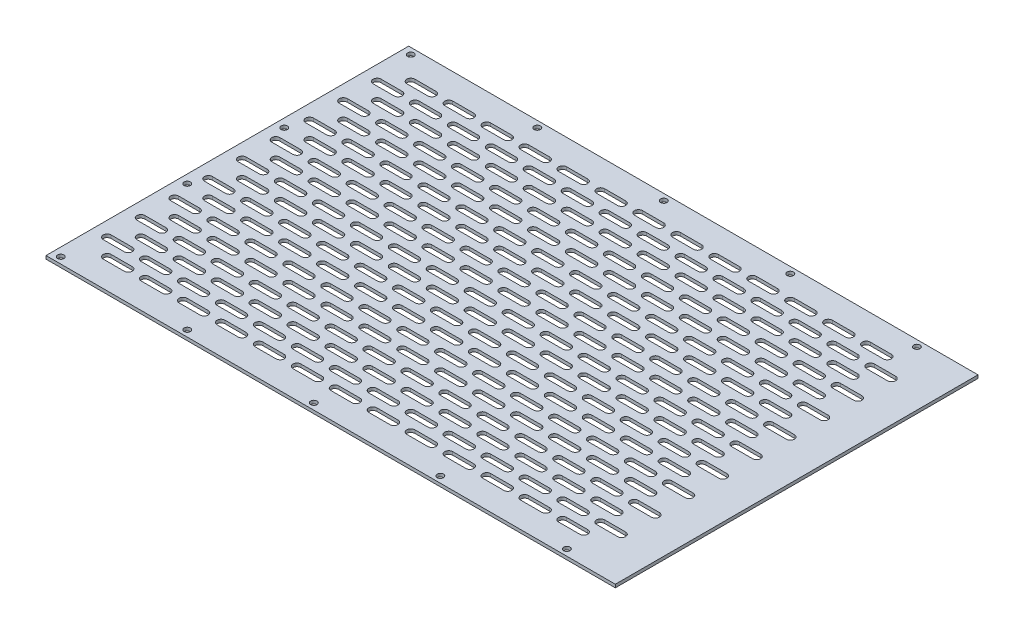
from build123d import *

# Parameters (mm, degrees)
SKETCH1_W           = 270
SKETCH1_H           = 172
SKETCH1_R           = 1.5
BOSS_EXTRUDE1_DEPTH = 1.5


with BuildPart() as part:
    # Sketch1 → Boss-Extrude1 (new body)
    with BuildSketch(Plane(origin=(0, 0, 0), x_dir=(1, 0, 0), z_dir=(0, 1, 0))):
        Rectangle(SKETCH1_W, SKETCH1_H)
        with Locations((-131, -83)):
            Circle(SKETCH1_R, mode=Mode.SUBTRACT)
        with Locations((-71, -83)):
            Circle(SKETCH1_R, mode=Mode.SUBTRACT)
        with Locations((-11, -83)):
            Circle(SKETCH1_R, mode=Mode.SUBTRACT)
        with Locations((49, -83)):
            Circle(SKETCH1_R, mode=Mode.SUBTRACT)
        with Locations((109, -83)):
            Circle(SKETCH1_R, mode=Mode.SUBTRACT)
        with Locations((-131, -23)):
            Circle(SKETCH1_R, mode=Mode.SUBTRACT)
        with Locations((109, 83)):
            Circle(SKETCH1_R, mode=Mode.SUBTRACT)
        with Locations((49, 83)):
            Circle(SKETCH1_R, mode=Mode.SUBTRACT)
        with Locations((-11, 83)):
            Circle(SKETCH1_R, mode=Mode.SUBTRACT)
        with Locations((-71, 83)):
            Circle(SKETCH1_R, mode=Mode.SUBTRACT)
        with Locations((-131, 83)):
            Circle(SKETCH1_R, mode=Mode.SUBTRACT)
        with Locations((-131, 23)):
            Circle(SKETCH1_R, mode=Mode.SUBTRACT)
        with BuildLine():
            Line((-120, 73.9), (-110, 73.9))
            ThreePointArc((-110, 73.9), (-108.1, 72), (-110, 70.1))
            Line((-110, 70.1), (-120, 70.1))
            ThreePointArc((-120, 70.1), (-121.9, 72), (-120, 73.9))
        make_face(mode=Mode.SUBTRACT)
        with BuildLine():
            Line((-102, 73.9), (-92, 73.9))
            ThreePointArc((-92, 73.9), (-90.1, 72), (-92, 70.1))
            Line((-92, 70.1), (-102, 70.1))
            ThreePointArc((-102, 70.1), (-103.9, 72), (-102, 73.9))
        make_face(mode=Mode.SUBTRACT)
        with BuildLine():
            Line((-84, 73.9), (-74, 73.9))
            ThreePointArc((-74, 73.9), (-72.1, 72), (-74, 70.1))
            Line((-74, 70.1), (-84, 70.1))
            ThreePointArc((-84, 70.1), (-85.9, 72), (-84, 73.9))
        make_face(mode=Mode.SUBTRACT)
        with BuildLine():
            Line((-66, 73.9), (-56, 73.9))
            ThreePointArc((-56, 73.9), (-54.1, 72), (-56, 70.1))
            Line((-56, 70.1), (-66, 70.1))
            ThreePointArc((-66, 70.1), (-67.9, 72), (-66, 73.9))
        make_face(mode=Mode.SUBTRACT)
        with BuildLine():
            Line((-48, 73.9), (-38, 73.9))
            ThreePointArc((-38, 73.9), (-36.1, 72), (-38, 70.1))
            Line((-38, 70.1), (-48, 70.1))
            ThreePointArc((-48, 70.1), (-49.9, 72), (-48, 73.9))
        make_face(mode=Mode.SUBTRACT)
        with BuildLine():
            Line((-30, 73.9), (-20, 73.9))
            ThreePointArc((-20, 73.9), (-18.1, 72), (-20, 70.1))
            Line((-20, 70.1), (-30, 70.1))
            ThreePointArc((-30, 70.1), (-31.9, 72), (-30, 73.9))
        make_face(mode=Mode.SUBTRACT)
        with BuildLine():
            Line((-12, 73.9), (-2, 73.9))
            ThreePointArc((-2, 73.9), (-0.1, 72), (-2, 70.1))
            Line((-2, 70.1), (-12, 70.1))
            ThreePointArc((-12, 70.1), (-13.9, 72), (-12, 73.9))
        make_face(mode=Mode.SUBTRACT)
        with BuildLine():
            Line((6, 73.9), (16, 73.9))
            ThreePointArc((16, 73.9), (17.9, 72), (16, 70.1))
            Line((16, 70.1), (6, 70.1))
            ThreePointArc((6, 70.1), (4.1, 72), (6, 73.9))
        make_face(mode=Mode.SUBTRACT)
        with BuildLine():
            Line((24, 73.9), (34, 73.9))
            ThreePointArc((34, 73.9), (35.9, 72), (34, 70.1))
            Line((34, 70.1), (24, 70.1))
            ThreePointArc((24, 70.1), (22.1, 72), (24, 73.9))
        make_face(mode=Mode.SUBTRACT)
        with BuildLine():
            Line((42, 73.9), (52, 73.9))
            ThreePointArc((52, 73.9), (53.9, 72), (52, 70.1))
            Line((52, 70.1), (42, 70.1))
            ThreePointArc((42, 70.1), (40.1, 72), (42, 73.9))
        make_face(mode=Mode.SUBTRACT)
        with BuildLine():
            Line((60, 73.9), (70, 73.9))
            ThreePointArc((70, 73.9), (71.9, 72), (70, 70.1))
            Line((70, 70.1), (60, 70.1))
            ThreePointArc((60, 70.1), (58.1, 72), (60, 73.9))
        make_face(mode=Mode.SUBTRACT)
        with BuildLine():
            Line((78, 73.9), (88, 73.9))
            ThreePointArc((88, 73.9), (89.9, 72), (88, 70.1))
            Line((88, 70.1), (78, 70.1))
            ThreePointArc((78, 70.1), (76.1, 72), (78, 73.9))
        make_face(mode=Mode.SUBTRACT)
        with BuildLine():
            Line((96, 73.9), (106, 73.9))
            ThreePointArc((106, 73.9), (107.9, 72), (106, 70.1))
            Line((106, 70.1), (96, 70.1))
            ThreePointArc((96, 70.1), (94.1, 72), (96, 73.9))
        make_face(mode=Mode.SUBTRACT)
        with BuildLine():
            Line((-102, 57.9), (-92, 57.9))
            ThreePointArc((-92, 57.9), (-90.1, 56), (-92, 54.1))
            Line((-92, 54.1), (-102, 54.1))
            ThreePointArc((-102, 54.1), (-103.9, 56), (-102, 57.9))
        make_face(mode=Mode.SUBTRACT)
        with BuildLine():
            Line((-84, 57.9), (-74, 57.9))
            ThreePointArc((-74, 57.9), (-72.1, 56), (-74, 54.1))
            Line((-74, 54.1), (-84, 54.1))
            ThreePointArc((-84, 54.1), (-85.9, 56), (-84, 57.9))
        make_face(mode=Mode.SUBTRACT)
        with BuildLine():
            Line((-66, 57.9), (-56, 57.9))
            ThreePointArc((-56, 57.9), (-54.1, 56), (-56, 54.1))
            Line((-56, 54.1), (-66, 54.1))
            ThreePointArc((-66, 54.1), (-67.9, 56), (-66, 57.9))
        make_face(mode=Mode.SUBTRACT)
        with BuildLine():
            Line((-48, 57.9), (-38, 57.9))
            ThreePointArc((-38, 57.9), (-36.1, 56), (-38, 54.1))
            Line((-38, 54.1), (-48, 54.1))
            ThreePointArc((-48, 54.1), (-49.9, 56), (-48, 57.9))
        make_face(mode=Mode.SUBTRACT)
        with BuildLine():
            Line((-30, 57.9), (-20, 57.9))
            ThreePointArc((-20, 57.9), (-18.1, 56), (-20, 54.1))
            Line((-20, 54.1), (-30, 54.1))
            ThreePointArc((-30, 54.1), (-31.9, 56), (-30, 57.9))
        make_face(mode=Mode.SUBTRACT)
        with BuildLine():
            Line((-12, 57.9), (-2, 57.9))
            ThreePointArc((-2, 57.9), (-0.1, 56), (-2, 54.1))
            Line((-2, 54.1), (-12, 54.1))
            ThreePointArc((-12, 54.1), (-13.9, 56), (-12, 57.9))
        make_face(mode=Mode.SUBTRACT)
        with BuildLine():
            Line((6, 57.9), (16, 57.9))
            ThreePointArc((16, 57.9), (17.9, 56), (16, 54.1))
            Line((16, 54.1), (6, 54.1))
            ThreePointArc((6, 54.1), (4.1, 56), (6, 57.9))
        make_face(mode=Mode.SUBTRACT)
        with BuildLine():
            Line((24, 57.9), (34, 57.9))
            ThreePointArc((34, 57.9), (35.9, 56), (34, 54.1))
            Line((34, 54.1), (24, 54.1))
            ThreePointArc((24, 54.1), (22.1, 56), (24, 57.9))
        make_face(mode=Mode.SUBTRACT)
        with BuildLine():
            Line((42, 57.9), (52, 57.9))
            ThreePointArc((52, 57.9), (53.9, 56), (52, 54.1))
            Line((52, 54.1), (42, 54.1))
            ThreePointArc((42, 54.1), (40.1, 56), (42, 57.9))
        make_face(mode=Mode.SUBTRACT)
        with BuildLine():
            Line((60, 57.9), (70, 57.9))
            ThreePointArc((70, 57.9), (71.9, 56), (70, 54.1))
            Line((70, 54.1), (60, 54.1))
            ThreePointArc((60, 54.1), (58.1, 56), (60, 57.9))
        make_face(mode=Mode.SUBTRACT)
        with BuildLine():
            Line((78, 57.9), (88, 57.9))
            ThreePointArc((88, 57.9), (89.9, 56), (88, 54.1))
            Line((88, 54.1), (78, 54.1))
            ThreePointArc((78, 54.1), (76.1, 56), (78, 57.9))
        make_face(mode=Mode.SUBTRACT)
        with BuildLine():
            Line((-102, 41.9), (-92, 41.9))
            ThreePointArc((-92, 41.9), (-90.1, 40), (-92, 38.1))
            Line((-92, 38.1), (-102, 38.1))
            ThreePointArc((-102, 38.1), (-103.9, 40), (-102, 41.9))
        make_face(mode=Mode.SUBTRACT)
        with BuildLine():
            Line((-84, 41.9), (-74, 41.9))
            ThreePointArc((-74, 41.9), (-72.1, 40), (-74, 38.1))
            Line((-74, 38.1), (-84, 38.1))
            ThreePointArc((-84, 38.1), (-85.9, 40), (-84, 41.9))
        make_face(mode=Mode.SUBTRACT)
        with BuildLine():
            Line((-66, 41.9), (-56, 41.9))
            ThreePointArc((-56, 41.9), (-54.1, 40), (-56, 38.1))
            Line((-56, 38.1), (-66, 38.1))
            ThreePointArc((-66, 38.1), (-67.9, 40), (-66, 41.9))
        make_face(mode=Mode.SUBTRACT)
        with BuildLine():
            Line((-48, 41.9), (-38, 41.9))
            ThreePointArc((-38, 41.9), (-36.1, 40), (-38, 38.1))
            Line((-38, 38.1), (-48, 38.1))
            ThreePointArc((-48, 38.1), (-49.9, 40), (-48, 41.9))
        make_face(mode=Mode.SUBTRACT)
        with BuildLine():
            Line((-30, 41.9), (-20, 41.9))
            ThreePointArc((-20, 41.9), (-18.1, 40), (-20, 38.1))
            Line((-20, 38.1), (-30, 38.1))
            ThreePointArc((-30, 38.1), (-31.9, 40), (-30, 41.9))
        make_face(mode=Mode.SUBTRACT)
        with BuildLine():
            Line((-12, 41.9), (-2, 41.9))
            ThreePointArc((-2, 41.9), (-0.1, 40), (-2, 38.1))
            Line((-2, 38.1), (-12, 38.1))
            ThreePointArc((-12, 38.1), (-13.9, 40), (-12, 41.9))
        make_face(mode=Mode.SUBTRACT)
        with BuildLine():
            Line((6, 41.9), (16, 41.9))
            ThreePointArc((16, 41.9), (17.9, 40), (16, 38.1))
            Line((16, 38.1), (6, 38.1))
            ThreePointArc((6, 38.1), (4.1, 40), (6, 41.9))
        make_face(mode=Mode.SUBTRACT)
        with BuildLine():
            Line((24, 41.9), (34, 41.9))
            ThreePointArc((34, 41.9), (35.9, 40), (34, 38.1))
            Line((34, 38.1), (24, 38.1))
            ThreePointArc((24, 38.1), (22.1, 40), (24, 41.9))
        make_face(mode=Mode.SUBTRACT)
        with BuildLine():
            Line((42, 41.9), (52, 41.9))
            ThreePointArc((52, 41.9), (53.9, 40), (52, 38.1))
            Line((52, 38.1), (42, 38.1))
            ThreePointArc((42, 38.1), (40.1, 40), (42, 41.9))
        make_face(mode=Mode.SUBTRACT)
        with BuildLine():
            Line((60, 41.9), (70, 41.9))
            ThreePointArc((70, 41.9), (71.9, 40), (70, 38.1))
            Line((70, 38.1), (60, 38.1))
            ThreePointArc((60, 38.1), (58.1, 40), (60, 41.9))
        make_face(mode=Mode.SUBTRACT)
        with BuildLine():
            Line((78, 41.9), (88, 41.9))
            ThreePointArc((88, 41.9), (89.9, 40), (88, 38.1))
            Line((88, 38.1), (78, 38.1))
            ThreePointArc((78, 38.1), (76.1, 40), (78, 41.9))
        make_face(mode=Mode.SUBTRACT)
        with BuildLine():
            Line((96, 57.9), (106, 57.9))
            ThreePointArc((106, 57.9), (107.9, 56), (106, 54.1))
            Line((106, 54.1), (96, 54.1))
            ThreePointArc((96, 54.1), (94.1, 56), (96, 57.9))
        make_face(mode=Mode.SUBTRACT)
        with BuildLine():
            Line((-102, 25.9), (-92, 25.9))
            ThreePointArc((-92, 25.9), (-90.1, 24), (-92, 22.1))
            Line((-92, 22.1), (-102, 22.1))
            ThreePointArc((-102, 22.1), (-103.9, 24), (-102, 25.9))
        make_face(mode=Mode.SUBTRACT)
        with BuildLine():
            Line((-84, 25.9), (-74, 25.9))
            ThreePointArc((-74, 25.9), (-72.1, 24), (-74, 22.1))
            Line((-74, 22.1), (-84, 22.1))
            ThreePointArc((-84, 22.1), (-85.9, 24), (-84, 25.9))
        make_face(mode=Mode.SUBTRACT)
        with BuildLine():
            Line((-66, 25.9), (-56, 25.9))
            ThreePointArc((-56, 25.9), (-54.1, 24), (-56, 22.1))
            Line((-56, 22.1), (-66, 22.1))
            ThreePointArc((-66, 22.1), (-67.9, 24), (-66, 25.9))
        make_face(mode=Mode.SUBTRACT)
        with BuildLine():
            Line((-48, 25.9), (-38, 25.9))
            ThreePointArc((-38, 25.9), (-36.1, 24), (-38, 22.1))
            Line((-38, 22.1), (-48, 22.1))
            ThreePointArc((-48, 22.1), (-49.9, 24), (-48, 25.9))
        make_face(mode=Mode.SUBTRACT)
        with BuildLine():
            Line((-30, 25.9), (-20, 25.9))
            ThreePointArc((-20, 25.9), (-18.1, 24), (-20, 22.1))
            Line((-20, 22.1), (-30, 22.1))
            ThreePointArc((-30, 22.1), (-31.9, 24), (-30, 25.9))
        make_face(mode=Mode.SUBTRACT)
        with BuildLine():
            Line((-12, 25.9), (-2, 25.9))
            ThreePointArc((-2, 25.9), (-0.1, 24), (-2, 22.1))
            Line((-2, 22.1), (-12, 22.1))
            ThreePointArc((-12, 22.1), (-13.9, 24), (-12, 25.9))
        make_face(mode=Mode.SUBTRACT)
        with BuildLine():
            Line((6, 25.9), (16, 25.9))
            ThreePointArc((16, 25.9), (17.9, 24), (16, 22.1))
            Line((16, 22.1), (6, 22.1))
            ThreePointArc((6, 22.1), (4.1, 24), (6, 25.9))
        make_face(mode=Mode.SUBTRACT)
        with BuildLine():
            Line((24, 25.9), (34, 25.9))
            ThreePointArc((34, 25.9), (35.9, 24), (34, 22.1))
            Line((34, 22.1), (24, 22.1))
            ThreePointArc((24, 22.1), (22.1, 24), (24, 25.9))
        make_face(mode=Mode.SUBTRACT)
        with BuildLine():
            Line((42, 25.9), (52, 25.9))
            ThreePointArc((52, 25.9), (53.9, 24), (52, 22.1))
            Line((52, 22.1), (42, 22.1))
            ThreePointArc((42, 22.1), (40.1, 24), (42, 25.9))
        make_face(mode=Mode.SUBTRACT)
        with BuildLine():
            Line((60, 25.9), (70, 25.9))
            ThreePointArc((70, 25.9), (71.9, 24), (70, 22.1))
            Line((70, 22.1), (60, 22.1))
            ThreePointArc((60, 22.1), (58.1, 24), (60, 25.9))
        make_face(mode=Mode.SUBTRACT)
        with BuildLine():
            Line((78, 25.9), (88, 25.9))
            ThreePointArc((88, 25.9), (89.9, 24), (88, 22.1))
            Line((88, 22.1), (78, 22.1))
            ThreePointArc((78, 22.1), (76.1, 24), (78, 25.9))
        make_face(mode=Mode.SUBTRACT)
        with BuildLine():
            Line((96, 41.9), (106, 41.9))
            ThreePointArc((106, 41.9), (107.9, 40), (106, 38.1))
            Line((106, 38.1), (96, 38.1))
            ThreePointArc((96, 38.1), (94.1, 40), (96, 41.9))
        make_face(mode=Mode.SUBTRACT)
        with BuildLine():
            Line((-102, 9.9), (-92, 9.9))
            ThreePointArc((-92, 9.9), (-90.1, 8), (-92, 6.1))
            Line((-92, 6.1), (-102, 6.1))
            ThreePointArc((-102, 6.1), (-103.9, 8), (-102, 9.9))
        make_face(mode=Mode.SUBTRACT)
        with BuildLine():
            Line((-84, 9.9), (-74, 9.9))
            ThreePointArc((-74, 9.9), (-72.1, 8), (-74, 6.1))
            Line((-74, 6.1), (-84, 6.1))
            ThreePointArc((-84, 6.1), (-85.9, 8), (-84, 9.9))
        make_face(mode=Mode.SUBTRACT)
        with BuildLine():
            Line((-66, 9.9), (-56, 9.9))
            ThreePointArc((-56, 9.9), (-54.1, 8), (-56, 6.1))
            Line((-56, 6.1), (-66, 6.1))
            ThreePointArc((-66, 6.1), (-67.9, 8), (-66, 9.9))
        make_face(mode=Mode.SUBTRACT)
        with BuildLine():
            Line((-48, 9.9), (-38, 9.9))
            ThreePointArc((-38, 9.9), (-36.1, 8), (-38, 6.1))
            Line((-38, 6.1), (-48, 6.1))
            ThreePointArc((-48, 6.1), (-49.9, 8), (-48, 9.9))
        make_face(mode=Mode.SUBTRACT)
        with BuildLine():
            Line((-30, 9.9), (-20, 9.9))
            ThreePointArc((-20, 9.9), (-18.1, 8), (-20, 6.1))
            Line((-20, 6.1), (-30, 6.1))
            ThreePointArc((-30, 6.1), (-31.9, 8), (-30, 9.9))
        make_face(mode=Mode.SUBTRACT)
        with BuildLine():
            Line((-12, 9.9), (-2, 9.9))
            ThreePointArc((-2, 9.9), (-0.1, 8), (-2, 6.1))
            Line((-2, 6.1), (-12, 6.1))
            ThreePointArc((-12, 6.1), (-13.9, 8), (-12, 9.9))
        make_face(mode=Mode.SUBTRACT)
        with BuildLine():
            Line((6, 9.9), (16, 9.9))
            ThreePointArc((16, 9.9), (17.9, 8), (16, 6.1))
            Line((16, 6.1), (6, 6.1))
            ThreePointArc((6, 6.1), (4.1, 8), (6, 9.9))
        make_face(mode=Mode.SUBTRACT)
        with BuildLine():
            Line((24, 9.9), (34, 9.9))
            ThreePointArc((34, 9.9), (35.9, 8), (34, 6.1))
            Line((34, 6.1), (24, 6.1))
            ThreePointArc((24, 6.1), (22.1, 8), (24, 9.9))
        make_face(mode=Mode.SUBTRACT)
        with BuildLine():
            Line((42, 9.9), (52, 9.9))
            ThreePointArc((52, 9.9), (53.9, 8), (52, 6.1))
            Line((52, 6.1), (42, 6.1))
            ThreePointArc((42, 6.1), (40.1, 8), (42, 9.9))
        make_face(mode=Mode.SUBTRACT)
        with BuildLine():
            Line((60, 9.9), (70, 9.9))
            ThreePointArc((70, 9.9), (71.9, 8), (70, 6.1))
            Line((70, 6.1), (60, 6.1))
            ThreePointArc((60, 6.1), (58.1, 8), (60, 9.9))
        make_face(mode=Mode.SUBTRACT)
        with BuildLine():
            Line((78, 9.9), (88, 9.9))
            ThreePointArc((88, 9.9), (89.9, 8), (88, 6.1))
            Line((88, 6.1), (78, 6.1))
            ThreePointArc((78, 6.1), (76.1, 8), (78, 9.9))
        make_face(mode=Mode.SUBTRACT)
        with BuildLine():
            Line((-102, -6.1), (-92, -6.1))
            ThreePointArc((-92, -6.1), (-90.1, -8), (-92, -9.9))
            Line((-92, -9.9), (-102, -9.9))
            ThreePointArc((-102, -9.9), (-103.9, -8), (-102, -6.1))
        make_face(mode=Mode.SUBTRACT)
        with BuildLine():
            Line((-84, -6.1), (-74, -6.1))
            ThreePointArc((-74, -6.1), (-72.1, -8), (-74, -9.9))
            Line((-74, -9.9), (-84, -9.9))
            ThreePointArc((-84, -9.9), (-85.9, -8), (-84, -6.1))
        make_face(mode=Mode.SUBTRACT)
        with BuildLine():
            Line((-66, -6.1), (-56, -6.1))
            ThreePointArc((-56, -6.1), (-54.1, -8), (-56, -9.9))
            Line((-56, -9.9), (-66, -9.9))
            ThreePointArc((-66, -9.9), (-67.9, -8), (-66, -6.1))
        make_face(mode=Mode.SUBTRACT)
        with BuildLine():
            Line((-48, -6.1), (-38, -6.1))
            ThreePointArc((-38, -6.1), (-36.1, -8), (-38, -9.9))
            Line((-38, -9.9), (-48, -9.9))
            ThreePointArc((-48, -9.9), (-49.9, -8), (-48, -6.1))
        make_face(mode=Mode.SUBTRACT)
        with BuildLine():
            Line((-30, -6.1), (-20, -6.1))
            ThreePointArc((-20, -6.1), (-18.1, -8), (-20, -9.9))
            Line((-20, -9.9), (-30, -9.9))
            ThreePointArc((-30, -9.9), (-31.9, -8), (-30, -6.1))
        make_face(mode=Mode.SUBTRACT)
        with BuildLine():
            Line((-12, -6.1), (-2, -6.1))
            ThreePointArc((-2, -6.1), (-0.1, -8), (-2, -9.9))
            Line((-2, -9.9), (-12, -9.9))
            ThreePointArc((-12, -9.9), (-13.9, -8), (-12, -6.1))
        make_face(mode=Mode.SUBTRACT)
        with BuildLine():
            Line((6, -6.1), (16, -6.1))
            ThreePointArc((16, -6.1), (17.9, -8), (16, -9.9))
            Line((16, -9.9), (6, -9.9))
            ThreePointArc((6, -9.9), (4.1, -8), (6, -6.1))
        make_face(mode=Mode.SUBTRACT)
        with BuildLine():
            Line((24, -6.1), (34, -6.1))
            ThreePointArc((34, -6.1), (35.9, -8), (34, -9.9))
            Line((34, -9.9), (24, -9.9))
            ThreePointArc((24, -9.9), (22.1, -8), (24, -6.1))
        make_face(mode=Mode.SUBTRACT)
        with BuildLine():
            Line((42, -6.1), (52, -6.1))
            ThreePointArc((52, -6.1), (53.9, -8), (52, -9.9))
            Line((52, -9.9), (42, -9.9))
            ThreePointArc((42, -9.9), (40.1, -8), (42, -6.1))
        make_face(mode=Mode.SUBTRACT)
        with BuildLine():
            Line((60, -6.1), (70, -6.1))
            ThreePointArc((70, -6.1), (71.9, -8), (70, -9.9))
            Line((70, -9.9), (60, -9.9))
            ThreePointArc((60, -9.9), (58.1, -8), (60, -6.1))
        make_face(mode=Mode.SUBTRACT)
        with BuildLine():
            Line((78, -6.1), (88, -6.1))
            ThreePointArc((88, -6.1), (89.9, -8), (88, -9.9))
            Line((88, -9.9), (78, -9.9))
            ThreePointArc((78, -9.9), (76.1, -8), (78, -6.1))
        make_face(mode=Mode.SUBTRACT)
        with BuildLine():
            Line((96, 25.9), (106, 25.9))
            ThreePointArc((106, 25.9), (107.9, 24), (106, 22.1))
            Line((106, 22.1), (96, 22.1))
            ThreePointArc((96, 22.1), (94.1, 24), (96, 25.9))
        make_face(mode=Mode.SUBTRACT)
        with BuildLine():
            Line((-102, -22.1), (-92, -22.1))
            ThreePointArc((-92, -22.1), (-90.1, -24), (-92, -25.9))
            Line((-92, -25.9), (-102, -25.9))
            ThreePointArc((-102, -25.9), (-103.9, -24), (-102, -22.1))
        make_face(mode=Mode.SUBTRACT)
        with BuildLine():
            Line((-84, -22.1), (-74, -22.1))
            ThreePointArc((-74, -22.1), (-72.1, -24), (-74, -25.9))
            Line((-74, -25.9), (-84, -25.9))
            ThreePointArc((-84, -25.9), (-85.9, -24), (-84, -22.1))
        make_face(mode=Mode.SUBTRACT)
        with BuildLine():
            Line((-66, -22.1), (-56, -22.1))
            ThreePointArc((-56, -22.1), (-54.1, -24), (-56, -25.9))
            Line((-56, -25.9), (-66, -25.9))
            ThreePointArc((-66, -25.9), (-67.9, -24), (-66, -22.1))
        make_face(mode=Mode.SUBTRACT)
        with BuildLine():
            Line((-48, -22.1), (-38, -22.1))
            ThreePointArc((-38, -22.1), (-36.1, -24), (-38, -25.9))
            Line((-38, -25.9), (-48, -25.9))
            ThreePointArc((-48, -25.9), (-49.9, -24), (-48, -22.1))
        make_face(mode=Mode.SUBTRACT)
        with BuildLine():
            Line((-30, -22.1), (-20, -22.1))
            ThreePointArc((-20, -22.1), (-18.1, -24), (-20, -25.9))
            Line((-20, -25.9), (-30, -25.9))
            ThreePointArc((-30, -25.9), (-31.9, -24), (-30, -22.1))
        make_face(mode=Mode.SUBTRACT)
        with BuildLine():
            Line((-12, -22.1), (-2, -22.1))
            ThreePointArc((-2, -22.1), (-0.1, -24), (-2, -25.9))
            Line((-2, -25.9), (-12, -25.9))
            ThreePointArc((-12, -25.9), (-13.9, -24), (-12, -22.1))
        make_face(mode=Mode.SUBTRACT)
        with BuildLine():
            Line((6, -22.1), (16, -22.1))
            ThreePointArc((16, -22.1), (17.9, -24), (16, -25.9))
            Line((16, -25.9), (6, -25.9))
            ThreePointArc((6, -25.9), (4.1, -24), (6, -22.1))
        make_face(mode=Mode.SUBTRACT)
        with BuildLine():
            Line((24, -22.1), (34, -22.1))
            ThreePointArc((34, -22.1), (35.9, -24), (34, -25.9))
            Line((34, -25.9), (24, -25.9))
            ThreePointArc((24, -25.9), (22.1, -24), (24, -22.1))
        make_face(mode=Mode.SUBTRACT)
        with BuildLine():
            Line((42, -22.1), (52, -22.1))
            ThreePointArc((52, -22.1), (53.9, -24), (52, -25.9))
            Line((52, -25.9), (42, -25.9))
            ThreePointArc((42, -25.9), (40.1, -24), (42, -22.1))
        make_face(mode=Mode.SUBTRACT)
        with BuildLine():
            Line((60, -22.1), (70, -22.1))
            ThreePointArc((70, -22.1), (71.9, -24), (70, -25.9))
            Line((70, -25.9), (60, -25.9))
            ThreePointArc((60, -25.9), (58.1, -24), (60, -22.1))
        make_face(mode=Mode.SUBTRACT)
        with BuildLine():
            Line((78, -22.1), (88, -22.1))
            ThreePointArc((88, -22.1), (89.9, -24), (88, -25.9))
            Line((88, -25.9), (78, -25.9))
            ThreePointArc((78, -25.9), (76.1, -24), (78, -22.1))
        make_face(mode=Mode.SUBTRACT)
        with BuildLine():
            Line((96, 9.9), (106, 9.9))
            ThreePointArc((106, 9.9), (107.9, 8), (106, 6.1))
            Line((106, 6.1), (96, 6.1))
            ThreePointArc((96, 6.1), (94.1, 8), (96, 9.9))
        make_face(mode=Mode.SUBTRACT)
        with BuildLine():
            Line((-102, -38.1), (-92, -38.1))
            ThreePointArc((-92, -38.1), (-90.1, -40), (-92, -41.9))
            Line((-92, -41.9), (-102, -41.9))
            ThreePointArc((-102, -41.9), (-103.9, -40), (-102, -38.1))
        make_face(mode=Mode.SUBTRACT)
        with BuildLine():
            Line((-84, -38.1), (-74, -38.1))
            ThreePointArc((-74, -38.1), (-72.1, -40), (-74, -41.9))
            Line((-74, -41.9), (-84, -41.9))
            ThreePointArc((-84, -41.9), (-85.9, -40), (-84, -38.1))
        make_face(mode=Mode.SUBTRACT)
        with BuildLine():
            Line((-66, -38.1), (-56, -38.1))
            ThreePointArc((-56, -38.1), (-54.1, -40), (-56, -41.9))
            Line((-56, -41.9), (-66, -41.9))
            ThreePointArc((-66, -41.9), (-67.9, -40), (-66, -38.1))
        make_face(mode=Mode.SUBTRACT)
        with BuildLine():
            Line((-48, -38.1), (-38, -38.1))
            ThreePointArc((-38, -38.1), (-36.1, -40), (-38, -41.9))
            Line((-38, -41.9), (-48, -41.9))
            ThreePointArc((-48, -41.9), (-49.9, -40), (-48, -38.1))
        make_face(mode=Mode.SUBTRACT)
        with BuildLine():
            Line((-30, -38.1), (-20, -38.1))
            ThreePointArc((-20, -38.1), (-18.1, -40), (-20, -41.9))
            Line((-20, -41.9), (-30, -41.9))
            ThreePointArc((-30, -41.9), (-31.9, -40), (-30, -38.1))
        make_face(mode=Mode.SUBTRACT)
        with BuildLine():
            Line((-12, -38.1), (-2, -38.1))
            ThreePointArc((-2, -38.1), (-0.1, -40), (-2, -41.9))
            Line((-2, -41.9), (-12, -41.9))
            ThreePointArc((-12, -41.9), (-13.9, -40), (-12, -38.1))
        make_face(mode=Mode.SUBTRACT)
        with BuildLine():
            Line((6, -38.1), (16, -38.1))
            ThreePointArc((16, -38.1), (17.9, -40), (16, -41.9))
            Line((16, -41.9), (6, -41.9))
            ThreePointArc((6, -41.9), (4.1, -40), (6, -38.1))
        make_face(mode=Mode.SUBTRACT)
        with BuildLine():
            Line((24, -38.1), (34, -38.1))
            ThreePointArc((34, -38.1), (35.9, -40), (34, -41.9))
            Line((34, -41.9), (24, -41.9))
            ThreePointArc((24, -41.9), (22.1, -40), (24, -38.1))
        make_face(mode=Mode.SUBTRACT)
        with BuildLine():
            Line((42, -38.1), (52, -38.1))
            ThreePointArc((52, -38.1), (53.9, -40), (52, -41.9))
            Line((52, -41.9), (42, -41.9))
            ThreePointArc((42, -41.9), (40.1, -40), (42, -38.1))
        make_face(mode=Mode.SUBTRACT)
        with BuildLine():
            Line((60, -38.1), (70, -38.1))
            ThreePointArc((70, -38.1), (71.9, -40), (70, -41.9))
            Line((70, -41.9), (60, -41.9))
            ThreePointArc((60, -41.9), (58.1, -40), (60, -38.1))
        make_face(mode=Mode.SUBTRACT)
        with BuildLine():
            Line((78, -38.1), (88, -38.1))
            ThreePointArc((88, -38.1), (89.9, -40), (88, -41.9))
            Line((88, -41.9), (78, -41.9))
            ThreePointArc((78, -41.9), (76.1, -40), (78, -38.1))
        make_face(mode=Mode.SUBTRACT)
        with BuildLine():
            Line((-102, -54.1), (-92, -54.1))
            ThreePointArc((-92, -54.1), (-90.1, -56), (-92, -57.9))
            Line((-92, -57.9), (-102, -57.9))
            ThreePointArc((-102, -57.9), (-103.9, -56), (-102, -54.1))
        make_face(mode=Mode.SUBTRACT)
        with BuildLine():
            Line((-84, -54.1), (-74, -54.1))
            ThreePointArc((-74, -54.1), (-72.1, -56), (-74, -57.9))
            Line((-74, -57.9), (-84, -57.9))
            ThreePointArc((-84, -57.9), (-85.9, -56), (-84, -54.1))
        make_face(mode=Mode.SUBTRACT)
        with BuildLine():
            Line((-66, -54.1), (-56, -54.1))
            ThreePointArc((-56, -54.1), (-54.1, -56), (-56, -57.9))
            Line((-56, -57.9), (-66, -57.9))
            ThreePointArc((-66, -57.9), (-67.9, -56), (-66, -54.1))
        make_face(mode=Mode.SUBTRACT)
        with BuildLine():
            Line((-48, -54.1), (-38, -54.1))
            ThreePointArc((-38, -54.1), (-36.1, -56), (-38, -57.9))
            Line((-38, -57.9), (-48, -57.9))
            ThreePointArc((-48, -57.9), (-49.9, -56), (-48, -54.1))
        make_face(mode=Mode.SUBTRACT)
        with BuildLine():
            Line((-30, -54.1), (-20, -54.1))
            ThreePointArc((-20, -54.1), (-18.1, -56), (-20, -57.9))
            Line((-20, -57.9), (-30, -57.9))
            ThreePointArc((-30, -57.9), (-31.9, -56), (-30, -54.1))
        make_face(mode=Mode.SUBTRACT)
        with BuildLine():
            Line((-12, -54.1), (-2, -54.1))
            ThreePointArc((-2, -54.1), (-0.1, -56), (-2, -57.9))
            Line((-2, -57.9), (-12, -57.9))
            ThreePointArc((-12, -57.9), (-13.9, -56), (-12, -54.1))
        make_face(mode=Mode.SUBTRACT)
        with BuildLine():
            Line((6, -54.1), (16, -54.1))
            ThreePointArc((16, -54.1), (17.9, -56), (16, -57.9))
            Line((16, -57.9), (6, -57.9))
            ThreePointArc((6, -57.9), (4.1, -56), (6, -54.1))
        make_face(mode=Mode.SUBTRACT)
        with BuildLine():
            Line((24, -54.1), (34, -54.1))
            ThreePointArc((34, -54.1), (35.9, -56), (34, -57.9))
            Line((34, -57.9), (24, -57.9))
            ThreePointArc((24, -57.9), (22.1, -56), (24, -54.1))
        make_face(mode=Mode.SUBTRACT)
        with BuildLine():
            Line((42, -54.1), (52, -54.1))
            ThreePointArc((52, -54.1), (53.9, -56), (52, -57.9))
            Line((52, -57.9), (42, -57.9))
            ThreePointArc((42, -57.9), (40.1, -56), (42, -54.1))
        make_face(mode=Mode.SUBTRACT)
        with BuildLine():
            Line((60, -54.1), (70, -54.1))
            ThreePointArc((70, -54.1), (71.9, -56), (70, -57.9))
            Line((70, -57.9), (60, -57.9))
            ThreePointArc((60, -57.9), (58.1, -56), (60, -54.1))
        make_face(mode=Mode.SUBTRACT)
        with BuildLine():
            Line((78, -54.1), (88, -54.1))
            ThreePointArc((88, -54.1), (89.9, -56), (88, -57.9))
            Line((88, -57.9), (78, -57.9))
            ThreePointArc((78, -57.9), (76.1, -56), (78, -54.1))
        make_face(mode=Mode.SUBTRACT)
        with BuildLine():
            Line((96, -6.1), (106, -6.1))
            ThreePointArc((106, -6.1), (107.9, -8), (106, -9.9))
            Line((106, -9.9), (96, -9.9))
            ThreePointArc((96, -9.9), (94.1, -8), (96, -6.1))
        make_face(mode=Mode.SUBTRACT)
        with BuildLine():
            Line((-102, -70.1), (-92, -70.1))
            ThreePointArc((-92, -70.1), (-90.1, -72), (-92, -73.9))
            Line((-92, -73.9), (-102, -73.9))
            ThreePointArc((-102, -73.9), (-103.9, -72), (-102, -70.1))
        make_face(mode=Mode.SUBTRACT)
        with BuildLine():
            Line((-84, -70.1), (-74, -70.1))
            ThreePointArc((-74, -70.1), (-72.1, -72), (-74, -73.9))
            Line((-74, -73.9), (-84, -73.9))
            ThreePointArc((-84, -73.9), (-85.9, -72), (-84, -70.1))
        make_face(mode=Mode.SUBTRACT)
        with BuildLine():
            Line((-66, -70.1), (-56, -70.1))
            ThreePointArc((-56, -70.1), (-54.1, -72), (-56, -73.9))
            Line((-56, -73.9), (-66, -73.9))
            ThreePointArc((-66, -73.9), (-67.9, -72), (-66, -70.1))
        make_face(mode=Mode.SUBTRACT)
        with BuildLine():
            Line((-48, -70.1), (-38, -70.1))
            ThreePointArc((-38, -70.1), (-36.1, -72), (-38, -73.9))
            Line((-38, -73.9), (-48, -73.9))
            ThreePointArc((-48, -73.9), (-49.9, -72), (-48, -70.1))
        make_face(mode=Mode.SUBTRACT)
        with BuildLine():
            Line((-30, -70.1), (-20, -70.1))
            ThreePointArc((-20, -70.1), (-18.1, -72), (-20, -73.9))
            Line((-20, -73.9), (-30, -73.9))
            ThreePointArc((-30, -73.9), (-31.9, -72), (-30, -70.1))
        make_face(mode=Mode.SUBTRACT)
        with BuildLine():
            Line((-12, -70.1), (-2, -70.1))
            ThreePointArc((-2, -70.1), (-0.1, -72), (-2, -73.9))
            Line((-2, -73.9), (-12, -73.9))
            ThreePointArc((-12, -73.9), (-13.9, -72), (-12, -70.1))
        make_face(mode=Mode.SUBTRACT)
        with BuildLine():
            Line((6, -70.1), (16, -70.1))
            ThreePointArc((16, -70.1), (17.9, -72), (16, -73.9))
            Line((16, -73.9), (6, -73.9))
            ThreePointArc((6, -73.9), (4.1, -72), (6, -70.1))
        make_face(mode=Mode.SUBTRACT)
        with BuildLine():
            Line((24, -70.1), (34, -70.1))
            ThreePointArc((34, -70.1), (35.9, -72), (34, -73.9))
            Line((34, -73.9), (24, -73.9))
            ThreePointArc((24, -73.9), (22.1, -72), (24, -70.1))
        make_face(mode=Mode.SUBTRACT)
        with BuildLine():
            Line((42, -70.1), (52, -70.1))
            ThreePointArc((52, -70.1), (53.9, -72), (52, -73.9))
            Line((52, -73.9), (42, -73.9))
            ThreePointArc((42, -73.9), (40.1, -72), (42, -70.1))
        make_face(mode=Mode.SUBTRACT)
        with BuildLine():
            Line((60, -70.1), (70, -70.1))
            ThreePointArc((70, -70.1), (71.9, -72), (70, -73.9))
            Line((70, -73.9), (60, -73.9))
            ThreePointArc((60, -73.9), (58.1, -72), (60, -70.1))
        make_face(mode=Mode.SUBTRACT)
        with BuildLine():
            Line((78, -70.1), (88, -70.1))
            ThreePointArc((88, -70.1), (89.9, -72), (88, -73.9))
            Line((88, -73.9), (78, -73.9))
            ThreePointArc((78, -73.9), (76.1, -72), (78, -70.1))
        make_face(mode=Mode.SUBTRACT)
        with BuildLine():
            Line((96, -22.1), (106, -22.1))
            ThreePointArc((106, -22.1), (107.9, -24), (106, -25.9))
            Line((106, -25.9), (96, -25.9))
            ThreePointArc((96, -25.9), (94.1, -24), (96, -22.1))
        make_face(mode=Mode.SUBTRACT)
        with BuildLine():
            Line((-120, 57.9), (-110, 57.9))
            ThreePointArc((-110, 57.9), (-108.1, 56), (-110, 54.1))
            Line((-110, 54.1), (-120, 54.1))
            ThreePointArc((-120, 54.1), (-121.9, 56), (-120, 57.9))
        make_face(mode=Mode.SUBTRACT)
        with BuildLine():
            Line((-120, 41.9), (-110, 41.9))
            ThreePointArc((-110, 41.9), (-108.1, 40), (-110, 38.1))
            Line((-110, 38.1), (-120, 38.1))
            ThreePointArc((-120, 38.1), (-121.9, 40), (-120, 41.9))
        make_face(mode=Mode.SUBTRACT)
        with BuildLine():
            Line((-120, 25.9), (-110, 25.9))
            ThreePointArc((-110, 25.9), (-108.1, 24), (-110, 22.1))
            Line((-110, 22.1), (-120, 22.1))
            ThreePointArc((-120, 22.1), (-121.9, 24), (-120, 25.9))
        make_face(mode=Mode.SUBTRACT)
        with BuildLine():
            Line((-120, 9.9), (-110, 9.9))
            ThreePointArc((-110, 9.9), (-108.1, 8), (-110, 6.1))
            Line((-110, 6.1), (-120, 6.1))
            ThreePointArc((-120, 6.1), (-121.9, 8), (-120, 9.9))
        make_face(mode=Mode.SUBTRACT)
        with BuildLine():
            Line((-120, -6.1), (-110, -6.1))
            ThreePointArc((-110, -6.1), (-108.1, -8), (-110, -9.9))
            Line((-110, -9.9), (-120, -9.9))
            ThreePointArc((-120, -9.9), (-121.9, -8), (-120, -6.1))
        make_face(mode=Mode.SUBTRACT)
        with BuildLine():
            Line((-120, -22.1), (-110, -22.1))
            ThreePointArc((-110, -22.1), (-108.1, -24), (-110, -25.9))
            Line((-110, -25.9), (-120, -25.9))
            ThreePointArc((-120, -25.9), (-121.9, -24), (-120, -22.1))
        make_face(mode=Mode.SUBTRACT)
        with BuildLine():
            Line((-120, -38.1), (-110, -38.1))
            ThreePointArc((-110, -38.1), (-108.1, -40), (-110, -41.9))
            Line((-110, -41.9), (-120, -41.9))
            ThreePointArc((-120, -41.9), (-121.9, -40), (-120, -38.1))
        make_face(mode=Mode.SUBTRACT)
        with BuildLine():
            Line((-120, -54.1), (-110, -54.1))
            ThreePointArc((-110, -54.1), (-108.1, -56), (-110, -57.9))
            Line((-110, -57.9), (-120, -57.9))
            ThreePointArc((-120, -57.9), (-121.9, -56), (-120, -54.1))
        make_face(mode=Mode.SUBTRACT)
        with BuildLine():
            Line((-120, -70.1), (-110, -70.1))
            ThreePointArc((-110, -70.1), (-108.1, -72), (-110, -73.9))
            Line((-110, -73.9), (-120, -73.9))
            ThreePointArc((-120, -73.9), (-121.9, -72), (-120, -70.1))
        make_face(mode=Mode.SUBTRACT)
        with BuildLine():
            Line((-110, 65.9), (-100, 65.9))
            ThreePointArc((-100, 65.9), (-98.1, 64), (-100, 62.1))
            Line((-100, 62.1), (-110, 62.1))
            ThreePointArc((-110, 62.1), (-111.9, 64), (-110, 65.9))
        make_face(mode=Mode.SUBTRACT)
        with BuildLine():
            Line((-92, 65.9), (-82, 65.9))
            ThreePointArc((-82, 65.9), (-80.1, 64), (-82, 62.1))
            Line((-82, 62.1), (-92, 62.1))
            ThreePointArc((-92, 62.1), (-93.9, 64), (-92, 65.9))
        make_face(mode=Mode.SUBTRACT)
        with BuildLine():
            Line((-74, 65.9), (-64, 65.9))
            ThreePointArc((-64, 65.9), (-62.1, 64), (-64, 62.1))
            Line((-64, 62.1), (-74, 62.1))
            ThreePointArc((-74, 62.1), (-75.9, 64), (-74, 65.9))
        make_face(mode=Mode.SUBTRACT)
        with BuildLine():
            Line((-56, 65.9), (-46, 65.9))
            ThreePointArc((-46, 65.9), (-44.1, 64), (-46, 62.1))
            Line((-46, 62.1), (-56, 62.1))
            ThreePointArc((-56, 62.1), (-57.9, 64), (-56, 65.9))
        make_face(mode=Mode.SUBTRACT)
        with BuildLine():
            Line((-38, 65.9), (-28, 65.9))
            ThreePointArc((-28, 65.9), (-26.1, 64), (-28, 62.1))
            Line((-28, 62.1), (-38, 62.1))
            ThreePointArc((-38, 62.1), (-39.9, 64), (-38, 65.9))
        make_face(mode=Mode.SUBTRACT)
        with BuildLine():
            Line((-20, 65.9), (-10, 65.9))
            ThreePointArc((-10, 65.9), (-8.1, 64), (-10, 62.1))
            Line((-10, 62.1), (-20, 62.1))
            ThreePointArc((-20, 62.1), (-21.9, 64), (-20, 65.9))
        make_face(mode=Mode.SUBTRACT)
        with BuildLine():
            Line((-2, 65.9), (8, 65.9))
            ThreePointArc((8, 65.9), (9.9, 64), (8, 62.1))
            Line((8, 62.1), (-2, 62.1))
            ThreePointArc((-2, 62.1), (-3.9, 64), (-2, 65.9))
        make_face(mode=Mode.SUBTRACT)
        with BuildLine():
            Line((16, 65.9), (26, 65.9))
            ThreePointArc((26, 65.9), (27.9, 64), (26, 62.1))
            Line((26, 62.1), (16, 62.1))
            ThreePointArc((16, 62.1), (14.1, 64), (16, 65.9))
        make_face(mode=Mode.SUBTRACT)
        with BuildLine():
            Line((34, 65.9), (44, 65.9))
            ThreePointArc((44, 65.9), (45.9, 64), (44, 62.1))
            Line((44, 62.1), (34, 62.1))
            ThreePointArc((34, 62.1), (32.1, 64), (34, 65.9))
        make_face(mode=Mode.SUBTRACT)
        with BuildLine():
            Line((52, 65.9), (62, 65.9))
            ThreePointArc((62, 65.9), (63.9, 64), (62, 62.1))
            Line((62, 62.1), (52, 62.1))
            ThreePointArc((52, 62.1), (50.1, 64), (52, 65.9))
        make_face(mode=Mode.SUBTRACT)
        with BuildLine():
            Line((70, 65.9), (80, 65.9))
            ThreePointArc((80, 65.9), (81.9, 64), (80, 62.1))
            Line((80, 62.1), (70, 62.1))
            ThreePointArc((70, 62.1), (68.1, 64), (70, 65.9))
        make_face(mode=Mode.SUBTRACT)
        with BuildLine():
            Line((88, 65.9), (98, 65.9))
            ThreePointArc((98, 65.9), (99.9, 64), (98, 62.1))
            Line((98, 62.1), (88, 62.1))
            ThreePointArc((88, 62.1), (86.1, 64), (88, 65.9))
        make_face(mode=Mode.SUBTRACT)
        with BuildLine():
            Line((-92, 49.9), (-82, 49.9))
            ThreePointArc((-82, 49.9), (-80.1, 48), (-82, 46.1))
            Line((-82, 46.1), (-92, 46.1))
            ThreePointArc((-92, 46.1), (-93.9, 48), (-92, 49.9))
        make_face(mode=Mode.SUBTRACT)
        with BuildLine():
            Line((-74, 49.9), (-64, 49.9))
            ThreePointArc((-64, 49.9), (-62.1, 48), (-64, 46.1))
            Line((-64, 46.1), (-74, 46.1))
            ThreePointArc((-74, 46.1), (-75.9, 48), (-74, 49.9))
        make_face(mode=Mode.SUBTRACT)
        with BuildLine():
            Line((-56, 49.9), (-46, 49.9))
            ThreePointArc((-46, 49.9), (-44.1, 48), (-46, 46.1))
            Line((-46, 46.1), (-56, 46.1))
            ThreePointArc((-56, 46.1), (-57.9, 48), (-56, 49.9))
        make_face(mode=Mode.SUBTRACT)
        with BuildLine():
            Line((-38, 49.9), (-28, 49.9))
            ThreePointArc((-28, 49.9), (-26.1, 48), (-28, 46.1))
            Line((-28, 46.1), (-38, 46.1))
            ThreePointArc((-38, 46.1), (-39.9, 48), (-38, 49.9))
        make_face(mode=Mode.SUBTRACT)
        with BuildLine():
            Line((-20, 49.9), (-10, 49.9))
            ThreePointArc((-10, 49.9), (-8.1, 48), (-10, 46.1))
            Line((-10, 46.1), (-20, 46.1))
            ThreePointArc((-20, 46.1), (-21.9, 48), (-20, 49.9))
        make_face(mode=Mode.SUBTRACT)
        with BuildLine():
            Line((-2, 49.9), (8, 49.9))
            ThreePointArc((8, 49.9), (9.9, 48), (8, 46.1))
            Line((8, 46.1), (-2, 46.1))
            ThreePointArc((-2, 46.1), (-3.9, 48), (-2, 49.9))
        make_face(mode=Mode.SUBTRACT)
        with BuildLine():
            Line((16, 49.9), (26, 49.9))
            ThreePointArc((26, 49.9), (27.9, 48), (26, 46.1))
            Line((26, 46.1), (16, 46.1))
            ThreePointArc((16, 46.1), (14.1, 48), (16, 49.9))
        make_face(mode=Mode.SUBTRACT)
        with BuildLine():
            Line((34, 49.9), (44, 49.9))
            ThreePointArc((44, 49.9), (45.9, 48), (44, 46.1))
            Line((44, 46.1), (34, 46.1))
            ThreePointArc((34, 46.1), (32.1, 48), (34, 49.9))
        make_face(mode=Mode.SUBTRACT)
        with BuildLine():
            Line((52, 49.9), (62, 49.9))
            ThreePointArc((62, 49.9), (63.9, 48), (62, 46.1))
            Line((62, 46.1), (52, 46.1))
            ThreePointArc((52, 46.1), (50.1, 48), (52, 49.9))
        make_face(mode=Mode.SUBTRACT)
        with BuildLine():
            Line((70, 49.9), (80, 49.9))
            ThreePointArc((80, 49.9), (81.9, 48), (80, 46.1))
            Line((80, 46.1), (70, 46.1))
            ThreePointArc((70, 46.1), (68.1, 48), (70, 49.9))
        make_face(mode=Mode.SUBTRACT)
        with BuildLine():
            Line((88, 49.9), (98, 49.9))
            ThreePointArc((98, 49.9), (99.9, 48), (98, 46.1))
            Line((98, 46.1), (88, 46.1))
            ThreePointArc((88, 46.1), (86.1, 48), (88, 49.9))
        make_face(mode=Mode.SUBTRACT)
        with BuildLine():
            Line((96, -38.1), (106, -38.1))
            ThreePointArc((106, -38.1), (107.9, -40), (106, -41.9))
            Line((106, -41.9), (96, -41.9))
            ThreePointArc((96, -41.9), (94.1, -40), (96, -38.1))
        make_face(mode=Mode.SUBTRACT)
        with BuildLine():
            Line((-92, 33.9), (-82, 33.9))
            ThreePointArc((-82, 33.9), (-80.1, 32), (-82, 30.1))
            Line((-82, 30.1), (-92, 30.1))
            ThreePointArc((-92, 30.1), (-93.9, 32), (-92, 33.9))
        make_face(mode=Mode.SUBTRACT)
        with BuildLine():
            Line((-74, 33.9), (-64, 33.9))
            ThreePointArc((-64, 33.9), (-62.1, 32), (-64, 30.1))
            Line((-64, 30.1), (-74, 30.1))
            ThreePointArc((-74, 30.1), (-75.9, 32), (-74, 33.9))
        make_face(mode=Mode.SUBTRACT)
        with BuildLine():
            Line((-56, 33.9), (-46, 33.9))
            ThreePointArc((-46, 33.9), (-44.1, 32), (-46, 30.1))
            Line((-46, 30.1), (-56, 30.1))
            ThreePointArc((-56, 30.1), (-57.9, 32), (-56, 33.9))
        make_face(mode=Mode.SUBTRACT)
        with BuildLine():
            Line((-38, 33.9), (-28, 33.9))
            ThreePointArc((-28, 33.9), (-26.1, 32), (-28, 30.1))
            Line((-28, 30.1), (-38, 30.1))
            ThreePointArc((-38, 30.1), (-39.9, 32), (-38, 33.9))
        make_face(mode=Mode.SUBTRACT)
        with BuildLine():
            Line((-20, 33.9), (-10, 33.9))
            ThreePointArc((-10, 33.9), (-8.1, 32), (-10, 30.1))
            Line((-10, 30.1), (-20, 30.1))
            ThreePointArc((-20, 30.1), (-21.9, 32), (-20, 33.9))
        make_face(mode=Mode.SUBTRACT)
        with BuildLine():
            Line((-2, 33.9), (8, 33.9))
            ThreePointArc((8, 33.9), (9.9, 32), (8, 30.1))
            Line((8, 30.1), (-2, 30.1))
            ThreePointArc((-2, 30.1), (-3.9, 32), (-2, 33.9))
        make_face(mode=Mode.SUBTRACT)
        with BuildLine():
            Line((16, 33.9), (26, 33.9))
            ThreePointArc((26, 33.9), (27.9, 32), (26, 30.1))
            Line((26, 30.1), (16, 30.1))
            ThreePointArc((16, 30.1), (14.1, 32), (16, 33.9))
        make_face(mode=Mode.SUBTRACT)
        with BuildLine():
            Line((34, 33.9), (44, 33.9))
            ThreePointArc((44, 33.9), (45.9, 32), (44, 30.1))
            Line((44, 30.1), (34, 30.1))
            ThreePointArc((34, 30.1), (32.1, 32), (34, 33.9))
        make_face(mode=Mode.SUBTRACT)
        with BuildLine():
            Line((52, 33.9), (62, 33.9))
            ThreePointArc((62, 33.9), (63.9, 32), (62, 30.1))
            Line((62, 30.1), (52, 30.1))
            ThreePointArc((52, 30.1), (50.1, 32), (52, 33.9))
        make_face(mode=Mode.SUBTRACT)
        with BuildLine():
            Line((70, 33.9), (80, 33.9))
            ThreePointArc((80, 33.9), (81.9, 32), (80, 30.1))
            Line((80, 30.1), (70, 30.1))
            ThreePointArc((70, 30.1), (68.1, 32), (70, 33.9))
        make_face(mode=Mode.SUBTRACT)
        with BuildLine():
            Line((88, 33.9), (98, 33.9))
            ThreePointArc((98, 33.9), (99.9, 32), (98, 30.1))
            Line((98, 30.1), (88, 30.1))
            ThreePointArc((88, 30.1), (86.1, 32), (88, 33.9))
        make_face(mode=Mode.SUBTRACT)
        with BuildLine():
            Line((96, -54.1), (106, -54.1))
            ThreePointArc((106, -54.1), (107.9, -56), (106, -57.9))
            Line((106, -57.9), (96, -57.9))
            ThreePointArc((96, -57.9), (94.1, -56), (96, -54.1))
        make_face(mode=Mode.SUBTRACT)
        with BuildLine():
            Line((-92, 17.9), (-82, 17.9))
            ThreePointArc((-82, 17.9), (-80.1, 16), (-82, 14.1))
            Line((-82, 14.1), (-92, 14.1))
            ThreePointArc((-92, 14.1), (-93.9, 16), (-92, 17.9))
        make_face(mode=Mode.SUBTRACT)
        with BuildLine():
            Line((-74, 17.9), (-64, 17.9))
            ThreePointArc((-64, 17.9), (-62.1, 16), (-64, 14.1))
            Line((-64, 14.1), (-74, 14.1))
            ThreePointArc((-74, 14.1), (-75.9, 16), (-74, 17.9))
        make_face(mode=Mode.SUBTRACT)
        with BuildLine():
            Line((-56, 17.9), (-46, 17.9))
            ThreePointArc((-46, 17.9), (-44.1, 16), (-46, 14.1))
            Line((-46, 14.1), (-56, 14.1))
            ThreePointArc((-56, 14.1), (-57.9, 16), (-56, 17.9))
        make_face(mode=Mode.SUBTRACT)
        with BuildLine():
            Line((-38, 17.9), (-28, 17.9))
            ThreePointArc((-28, 17.9), (-26.1, 16), (-28, 14.1))
            Line((-28, 14.1), (-38, 14.1))
            ThreePointArc((-38, 14.1), (-39.9, 16), (-38, 17.9))
        make_face(mode=Mode.SUBTRACT)
        with BuildLine():
            Line((-20, 17.9), (-10, 17.9))
            ThreePointArc((-10, 17.9), (-8.1, 16), (-10, 14.1))
            Line((-10, 14.1), (-20, 14.1))
            ThreePointArc((-20, 14.1), (-21.9, 16), (-20, 17.9))
        make_face(mode=Mode.SUBTRACT)
        with BuildLine():
            Line((-2, 17.9), (8, 17.9))
            ThreePointArc((8, 17.9), (9.9, 16), (8, 14.1))
            Line((8, 14.1), (-2, 14.1))
            ThreePointArc((-2, 14.1), (-3.9, 16), (-2, 17.9))
        make_face(mode=Mode.SUBTRACT)
        with BuildLine():
            Line((16, 17.9), (26, 17.9))
            ThreePointArc((26, 17.9), (27.9, 16), (26, 14.1))
            Line((26, 14.1), (16, 14.1))
            ThreePointArc((16, 14.1), (14.1, 16), (16, 17.9))
        make_face(mode=Mode.SUBTRACT)
        with BuildLine():
            Line((34, 17.9), (44, 17.9))
            ThreePointArc((44, 17.9), (45.9, 16), (44, 14.1))
            Line((44, 14.1), (34, 14.1))
            ThreePointArc((34, 14.1), (32.1, 16), (34, 17.9))
        make_face(mode=Mode.SUBTRACT)
        with BuildLine():
            Line((52, 17.9), (62, 17.9))
            ThreePointArc((62, 17.9), (63.9, 16), (62, 14.1))
            Line((62, 14.1), (52, 14.1))
            ThreePointArc((52, 14.1), (50.1, 16), (52, 17.9))
        make_face(mode=Mode.SUBTRACT)
        with BuildLine():
            Line((70, 17.9), (80, 17.9))
            ThreePointArc((80, 17.9), (81.9, 16), (80, 14.1))
            Line((80, 14.1), (70, 14.1))
            ThreePointArc((70, 14.1), (68.1, 16), (70, 17.9))
        make_face(mode=Mode.SUBTRACT)
        with BuildLine():
            Line((88, 17.9), (98, 17.9))
            ThreePointArc((98, 17.9), (99.9, 16), (98, 14.1))
            Line((98, 14.1), (88, 14.1))
            ThreePointArc((88, 14.1), (86.1, 16), (88, 17.9))
        make_face(mode=Mode.SUBTRACT)
        with BuildLine():
            Line((-92, 1.9), (-82, 1.9))
            ThreePointArc((-82, 1.9), (-80.1, 0), (-82, -1.9))
            Line((-82, -1.9), (-92, -1.9))
            ThreePointArc((-92, -1.9), (-93.9, 0), (-92, 1.9))
        make_face(mode=Mode.SUBTRACT)
        with BuildLine():
            Line((-74, 1.9), (-64, 1.9))
            ThreePointArc((-64, 1.9), (-62.1, 0), (-64, -1.9))
            Line((-64, -1.9), (-74, -1.9))
            ThreePointArc((-74, -1.9), (-75.9, 0), (-74, 1.9))
        make_face(mode=Mode.SUBTRACT)
        with BuildLine():
            Line((-56, 1.9), (-46, 1.9))
            ThreePointArc((-46, 1.9), (-44.1, 0), (-46, -1.9))
            Line((-46, -1.9), (-56, -1.9))
            ThreePointArc((-56, -1.9), (-57.9, 0), (-56, 1.9))
        make_face(mode=Mode.SUBTRACT)
        with BuildLine():
            Line((-38, 1.9), (-28, 1.9))
            ThreePointArc((-28, 1.9), (-26.1, 0), (-28, -1.9))
            Line((-28, -1.9), (-38, -1.9))
            ThreePointArc((-38, -1.9), (-39.9, 0), (-38, 1.9))
        make_face(mode=Mode.SUBTRACT)
        with BuildLine():
            Line((-20, 1.9), (-10, 1.9))
            ThreePointArc((-10, 1.9), (-8.1, 0), (-10, -1.9))
            Line((-10, -1.9), (-20, -1.9))
            ThreePointArc((-20, -1.9), (-21.9, 0), (-20, 1.9))
        make_face(mode=Mode.SUBTRACT)
        with BuildLine():
            Line((-2, 1.9), (8, 1.9))
            ThreePointArc((8, 1.9), (9.9, 0), (8, -1.9))
            Line((8, -1.9), (-2, -1.9))
            ThreePointArc((-2, -1.9), (-3.9, 0), (-2, 1.9))
        make_face(mode=Mode.SUBTRACT)
        with BuildLine():
            Line((16, 1.9), (26, 1.9))
            ThreePointArc((26, 1.9), (27.9, 0), (26, -1.9))
            Line((26, -1.9), (16, -1.9))
            ThreePointArc((16, -1.9), (14.1, 0), (16, 1.9))
        make_face(mode=Mode.SUBTRACT)
        with BuildLine():
            Line((34, 1.9), (44, 1.9))
            ThreePointArc((44, 1.9), (45.9, 0), (44, -1.9))
            Line((44, -1.9), (34, -1.9))
            ThreePointArc((34, -1.9), (32.1, 0), (34, 1.9))
        make_face(mode=Mode.SUBTRACT)
        with BuildLine():
            Line((52, 1.9), (62, 1.9))
            ThreePointArc((62, 1.9), (63.9, 0), (62, -1.9))
            Line((62, -1.9), (52, -1.9))
            ThreePointArc((52, -1.9), (50.1, 0), (52, 1.9))
        make_face(mode=Mode.SUBTRACT)
        with BuildLine():
            Line((70, 1.9), (80, 1.9))
            ThreePointArc((80, 1.9), (81.9, 0), (80, -1.9))
            Line((80, -1.9), (70, -1.9))
            ThreePointArc((70, -1.9), (68.1, 0), (70, 1.9))
        make_face(mode=Mode.SUBTRACT)
        with BuildLine():
            Line((88, 1.9), (98, 1.9))
            ThreePointArc((98, 1.9), (99.9, 0), (98, -1.9))
            Line((98, -1.9), (88, -1.9))
            ThreePointArc((88, -1.9), (86.1, 0), (88, 1.9))
        make_face(mode=Mode.SUBTRACT)
        with BuildLine():
            Line((96, -70.1), (106, -70.1))
            ThreePointArc((106, -70.1), (107.9, -72), (106, -73.9))
            Line((106, -73.9), (96, -73.9))
            ThreePointArc((96, -73.9), (94.1, -72), (96, -70.1))
        make_face(mode=Mode.SUBTRACT)
        with BuildLine():
            Line((-92, -14.1), (-82, -14.1))
            ThreePointArc((-82, -14.1), (-80.1, -16), (-82, -17.9))
            Line((-82, -17.9), (-92, -17.9))
            ThreePointArc((-92, -17.9), (-93.9, -16), (-92, -14.1))
        make_face(mode=Mode.SUBTRACT)
        with BuildLine():
            Line((-74, -14.1), (-64, -14.1))
            ThreePointArc((-64, -14.1), (-62.1, -16), (-64, -17.9))
            Line((-64, -17.9), (-74, -17.9))
            ThreePointArc((-74, -17.9), (-75.9, -16), (-74, -14.1))
        make_face(mode=Mode.SUBTRACT)
        with BuildLine():
            Line((-56, -14.1), (-46, -14.1))
            ThreePointArc((-46, -14.1), (-44.1, -16), (-46, -17.9))
            Line((-46, -17.9), (-56, -17.9))
            ThreePointArc((-56, -17.9), (-57.9, -16), (-56, -14.1))
        make_face(mode=Mode.SUBTRACT)
        with BuildLine():
            Line((-38, -14.1), (-28, -14.1))
            ThreePointArc((-28, -14.1), (-26.1, -16), (-28, -17.9))
            Line((-28, -17.9), (-38, -17.9))
            ThreePointArc((-38, -17.9), (-39.9, -16), (-38, -14.1))
        make_face(mode=Mode.SUBTRACT)
        with BuildLine():
            Line((-20, -14.1), (-10, -14.1))
            ThreePointArc((-10, -14.1), (-8.1, -16), (-10, -17.9))
            Line((-10, -17.9), (-20, -17.9))
            ThreePointArc((-20, -17.9), (-21.9, -16), (-20, -14.1))
        make_face(mode=Mode.SUBTRACT)
        with BuildLine():
            Line((-2, -14.1), (8, -14.1))
            ThreePointArc((8, -14.1), (9.9, -16), (8, -17.9))
            Line((8, -17.9), (-2, -17.9))
            ThreePointArc((-2, -17.9), (-3.9, -16), (-2, -14.1))
        make_face(mode=Mode.SUBTRACT)
        with BuildLine():
            Line((16, -14.1), (26, -14.1))
            ThreePointArc((26, -14.1), (27.9, -16), (26, -17.9))
            Line((26, -17.9), (16, -17.9))
            ThreePointArc((16, -17.9), (14.1, -16), (16, -14.1))
        make_face(mode=Mode.SUBTRACT)
        with BuildLine():
            Line((34, -14.1), (44, -14.1))
            ThreePointArc((44, -14.1), (45.9, -16), (44, -17.9))
            Line((44, -17.9), (34, -17.9))
            ThreePointArc((34, -17.9), (32.1, -16), (34, -14.1))
        make_face(mode=Mode.SUBTRACT)
        with BuildLine():
            Line((52, -14.1), (62, -14.1))
            ThreePointArc((62, -14.1), (63.9, -16), (62, -17.9))
            Line((62, -17.9), (52, -17.9))
            ThreePointArc((52, -17.9), (50.1, -16), (52, -14.1))
        make_face(mode=Mode.SUBTRACT)
        with BuildLine():
            Line((70, -14.1), (80, -14.1))
            ThreePointArc((80, -14.1), (81.9, -16), (80, -17.9))
            Line((80, -17.9), (70, -17.9))
            ThreePointArc((70, -17.9), (68.1, -16), (70, -14.1))
        make_face(mode=Mode.SUBTRACT)
        with BuildLine():
            Line((88, -14.1), (98, -14.1))
            ThreePointArc((98, -14.1), (99.9, -16), (98, -17.9))
            Line((98, -17.9), (88, -17.9))
            ThreePointArc((88, -17.9), (86.1, -16), (88, -14.1))
        make_face(mode=Mode.SUBTRACT)
        with BuildLine():
            Line((106, 65.9), (116, 65.9))
            ThreePointArc((116, 65.9), (117.9, 64), (116, 62.1))
            Line((116, 62.1), (106, 62.1))
            ThreePointArc((106, 62.1), (104.1, 64), (106, 65.9))
        make_face(mode=Mode.SUBTRACT)
        with BuildLine():
            Line((-92, -30.1), (-82, -30.1))
            ThreePointArc((-82, -30.1), (-80.1, -32), (-82, -33.9))
            Line((-82, -33.9), (-92, -33.9))
            ThreePointArc((-92, -33.9), (-93.9, -32), (-92, -30.1))
        make_face(mode=Mode.SUBTRACT)
        with BuildLine():
            Line((-74, -30.1), (-64, -30.1))
            ThreePointArc((-64, -30.1), (-62.1, -32), (-64, -33.9))
            Line((-64, -33.9), (-74, -33.9))
            ThreePointArc((-74, -33.9), (-75.9, -32), (-74, -30.1))
        make_face(mode=Mode.SUBTRACT)
        with BuildLine():
            Line((-56, -30.1), (-46, -30.1))
            ThreePointArc((-46, -30.1), (-44.1, -32), (-46, -33.9))
            Line((-46, -33.9), (-56, -33.9))
            ThreePointArc((-56, -33.9), (-57.9, -32), (-56, -30.1))
        make_face(mode=Mode.SUBTRACT)
        with BuildLine():
            Line((-38, -30.1), (-28, -30.1))
            ThreePointArc((-28, -30.1), (-26.1, -32), (-28, -33.9))
            Line((-28, -33.9), (-38, -33.9))
            ThreePointArc((-38, -33.9), (-39.9, -32), (-38, -30.1))
        make_face(mode=Mode.SUBTRACT)
        with BuildLine():
            Line((-20, -30.1), (-10, -30.1))
            ThreePointArc((-10, -30.1), (-8.1, -32), (-10, -33.9))
            Line((-10, -33.9), (-20, -33.9))
            ThreePointArc((-20, -33.9), (-21.9, -32), (-20, -30.1))
        make_face(mode=Mode.SUBTRACT)
        with BuildLine():
            Line((-2, -30.1), (8, -30.1))
            ThreePointArc((8, -30.1), (9.9, -32), (8, -33.9))
            Line((8, -33.9), (-2, -33.9))
            ThreePointArc((-2, -33.9), (-3.9, -32), (-2, -30.1))
        make_face(mode=Mode.SUBTRACT)
        with BuildLine():
            Line((16, -30.1), (26, -30.1))
            ThreePointArc((26, -30.1), (27.9, -32), (26, -33.9))
            Line((26, -33.9), (16, -33.9))
            ThreePointArc((16, -33.9), (14.1, -32), (16, -30.1))
        make_face(mode=Mode.SUBTRACT)
        with BuildLine():
            Line((34, -30.1), (44, -30.1))
            ThreePointArc((44, -30.1), (45.9, -32), (44, -33.9))
            Line((44, -33.9), (34, -33.9))
            ThreePointArc((34, -33.9), (32.1, -32), (34, -30.1))
        make_face(mode=Mode.SUBTRACT)
        with BuildLine():
            Line((52, -30.1), (62, -30.1))
            ThreePointArc((62, -30.1), (63.9, -32), (62, -33.9))
            Line((62, -33.9), (52, -33.9))
            ThreePointArc((52, -33.9), (50.1, -32), (52, -30.1))
        make_face(mode=Mode.SUBTRACT)
        with BuildLine():
            Line((70, -30.1), (80, -30.1))
            ThreePointArc((80, -30.1), (81.9, -32), (80, -33.9))
            Line((80, -33.9), (70, -33.9))
            ThreePointArc((70, -33.9), (68.1, -32), (70, -30.1))
        make_face(mode=Mode.SUBTRACT)
        with BuildLine():
            Line((88, -30.1), (98, -30.1))
            ThreePointArc((98, -30.1), (99.9, -32), (98, -33.9))
            Line((98, -33.9), (88, -33.9))
            ThreePointArc((88, -33.9), (86.1, -32), (88, -30.1))
        make_face(mode=Mode.SUBTRACT)
        with BuildLine():
            Line((-92, -46.1), (-82, -46.1))
            ThreePointArc((-82, -46.1), (-80.1, -48), (-82, -49.9))
            Line((-82, -49.9), (-92, -49.9))
            ThreePointArc((-92, -49.9), (-93.9, -48), (-92, -46.1))
        make_face(mode=Mode.SUBTRACT)
        with BuildLine():
            Line((-74, -46.1), (-64, -46.1))
            ThreePointArc((-64, -46.1), (-62.1, -48), (-64, -49.9))
            Line((-64, -49.9), (-74, -49.9))
            ThreePointArc((-74, -49.9), (-75.9, -48), (-74, -46.1))
        make_face(mode=Mode.SUBTRACT)
        with BuildLine():
            Line((-56, -46.1), (-46, -46.1))
            ThreePointArc((-46, -46.1), (-44.1, -48), (-46, -49.9))
            Line((-46, -49.9), (-56, -49.9))
            ThreePointArc((-56, -49.9), (-57.9, -48), (-56, -46.1))
        make_face(mode=Mode.SUBTRACT)
        with BuildLine():
            Line((-38, -46.1), (-28, -46.1))
            ThreePointArc((-28, -46.1), (-26.1, -48), (-28, -49.9))
            Line((-28, -49.9), (-38, -49.9))
            ThreePointArc((-38, -49.9), (-39.9, -48), (-38, -46.1))
        make_face(mode=Mode.SUBTRACT)
        with BuildLine():
            Line((-20, -46.1), (-10, -46.1))
            ThreePointArc((-10, -46.1), (-8.1, -48), (-10, -49.9))
            Line((-10, -49.9), (-20, -49.9))
            ThreePointArc((-20, -49.9), (-21.9, -48), (-20, -46.1))
        make_face(mode=Mode.SUBTRACT)
        with BuildLine():
            Line((-2, -46.1), (8, -46.1))
            ThreePointArc((8, -46.1), (9.9, -48), (8, -49.9))
            Line((8, -49.9), (-2, -49.9))
            ThreePointArc((-2, -49.9), (-3.9, -48), (-2, -46.1))
        make_face(mode=Mode.SUBTRACT)
        with BuildLine():
            Line((16, -46.1), (26, -46.1))
            ThreePointArc((26, -46.1), (27.9, -48), (26, -49.9))
            Line((26, -49.9), (16, -49.9))
            ThreePointArc((16, -49.9), (14.1, -48), (16, -46.1))
        make_face(mode=Mode.SUBTRACT)
        with BuildLine():
            Line((34, -46.1), (44, -46.1))
            ThreePointArc((44, -46.1), (45.9, -48), (44, -49.9))
            Line((44, -49.9), (34, -49.9))
            ThreePointArc((34, -49.9), (32.1, -48), (34, -46.1))
        make_face(mode=Mode.SUBTRACT)
        with BuildLine():
            Line((52, -46.1), (62, -46.1))
            ThreePointArc((62, -46.1), (63.9, -48), (62, -49.9))
            Line((62, -49.9), (52, -49.9))
            ThreePointArc((52, -49.9), (50.1, -48), (52, -46.1))
        make_face(mode=Mode.SUBTRACT)
        with BuildLine():
            Line((70, -46.1), (80, -46.1))
            ThreePointArc((80, -46.1), (81.9, -48), (80, -49.9))
            Line((80, -49.9), (70, -49.9))
            ThreePointArc((70, -49.9), (68.1, -48), (70, -46.1))
        make_face(mode=Mode.SUBTRACT)
        with BuildLine():
            Line((88, -46.1), (98, -46.1))
            ThreePointArc((98, -46.1), (99.9, -48), (98, -49.9))
            Line((98, -49.9), (88, -49.9))
            ThreePointArc((88, -49.9), (86.1, -48), (88, -46.1))
        make_face(mode=Mode.SUBTRACT)
        with BuildLine():
            Line((106, 49.9), (116, 49.9))
            ThreePointArc((116, 49.9), (117.9, 48), (116, 46.1))
            Line((116, 46.1), (106, 46.1))
            ThreePointArc((106, 46.1), (104.1, 48), (106, 49.9))
        make_face(mode=Mode.SUBTRACT)
        with BuildLine():
            Line((-92, -62.1), (-82, -62.1))
            ThreePointArc((-82, -62.1), (-80.1, -64), (-82, -65.9))
            Line((-82, -65.9), (-92, -65.9))
            ThreePointArc((-92, -65.9), (-93.9, -64), (-92, -62.1))
        make_face(mode=Mode.SUBTRACT)
        with BuildLine():
            Line((-74, -62.1), (-64, -62.1))
            ThreePointArc((-64, -62.1), (-62.1, -64), (-64, -65.9))
            Line((-64, -65.9), (-74, -65.9))
            ThreePointArc((-74, -65.9), (-75.9, -64), (-74, -62.1))
        make_face(mode=Mode.SUBTRACT)
        with BuildLine():
            Line((-56, -62.1), (-46, -62.1))
            ThreePointArc((-46, -62.1), (-44.1, -64), (-46, -65.9))
            Line((-46, -65.9), (-56, -65.9))
            ThreePointArc((-56, -65.9), (-57.9, -64), (-56, -62.1))
        make_face(mode=Mode.SUBTRACT)
        with BuildLine():
            Line((-38, -62.1), (-28, -62.1))
            ThreePointArc((-28, -62.1), (-26.1, -64), (-28, -65.9))
            Line((-28, -65.9), (-38, -65.9))
            ThreePointArc((-38, -65.9), (-39.9, -64), (-38, -62.1))
        make_face(mode=Mode.SUBTRACT)
        with BuildLine():
            Line((-20, -62.1), (-10, -62.1))
            ThreePointArc((-10, -62.1), (-8.1, -64), (-10, -65.9))
            Line((-10, -65.9), (-20, -65.9))
            ThreePointArc((-20, -65.9), (-21.9, -64), (-20, -62.1))
        make_face(mode=Mode.SUBTRACT)
        with BuildLine():
            Line((-2, -62.1), (8, -62.1))
            ThreePointArc((8, -62.1), (9.9, -64), (8, -65.9))
            Line((8, -65.9), (-2, -65.9))
            ThreePointArc((-2, -65.9), (-3.9, -64), (-2, -62.1))
        make_face(mode=Mode.SUBTRACT)
        with BuildLine():
            Line((16, -62.1), (26, -62.1))
            ThreePointArc((26, -62.1), (27.9, -64), (26, -65.9))
            Line((26, -65.9), (16, -65.9))
            ThreePointArc((16, -65.9), (14.1, -64), (16, -62.1))
        make_face(mode=Mode.SUBTRACT)
        with BuildLine():
            Line((34, -62.1), (44, -62.1))
            ThreePointArc((44, -62.1), (45.9, -64), (44, -65.9))
            Line((44, -65.9), (34, -65.9))
            ThreePointArc((34, -65.9), (32.1, -64), (34, -62.1))
        make_face(mode=Mode.SUBTRACT)
        with BuildLine():
            Line((52, -62.1), (62, -62.1))
            ThreePointArc((62, -62.1), (63.9, -64), (62, -65.9))
            Line((62, -65.9), (52, -65.9))
            ThreePointArc((52, -65.9), (50.1, -64), (52, -62.1))
        make_face(mode=Mode.SUBTRACT)
        with BuildLine():
            Line((70, -62.1), (80, -62.1))
            ThreePointArc((80, -62.1), (81.9, -64), (80, -65.9))
            Line((80, -65.9), (70, -65.9))
            ThreePointArc((70, -65.9), (68.1, -64), (70, -62.1))
        make_face(mode=Mode.SUBTRACT)
        with BuildLine():
            Line((88, -62.1), (98, -62.1))
            ThreePointArc((98, -62.1), (99.9, -64), (98, -65.9))
            Line((98, -65.9), (88, -65.9))
            ThreePointArc((88, -65.9), (86.1, -64), (88, -62.1))
        make_face(mode=Mode.SUBTRACT)
        with BuildLine():
            Line((106, 33.9), (116, 33.9))
            ThreePointArc((116, 33.9), (117.9, 32), (116, 30.1))
            Line((116, 30.1), (106, 30.1))
            ThreePointArc((106, 30.1), (104.1, 32), (106, 33.9))
        make_face(mode=Mode.SUBTRACT)
        with BuildLine():
            Line((-110, 49.9), (-100, 49.9))
            ThreePointArc((-100, 49.9), (-98.1, 48), (-100, 46.1))
            Line((-100, 46.1), (-110, 46.1))
            ThreePointArc((-110, 46.1), (-111.9, 48), (-110, 49.9))
        make_face(mode=Mode.SUBTRACT)
        with BuildLine():
            Line((-110, 33.9), (-100, 33.9))
            ThreePointArc((-100, 33.9), (-98.1, 32), (-100, 30.1))
            Line((-100, 30.1), (-110, 30.1))
            ThreePointArc((-110, 30.1), (-111.9, 32), (-110, 33.9))
        make_face(mode=Mode.SUBTRACT)
        with BuildLine():
            Line((-110, 17.9), (-100, 17.9))
            ThreePointArc((-100, 17.9), (-98.1, 16), (-100, 14.1))
            Line((-100, 14.1), (-110, 14.1))
            ThreePointArc((-110, 14.1), (-111.9, 16), (-110, 17.9))
        make_face(mode=Mode.SUBTRACT)
        with BuildLine():
            Line((-110, 1.9), (-100, 1.9))
            ThreePointArc((-100, 1.9), (-98.1, 0), (-100, -1.9))
            Line((-100, -1.9), (-110, -1.9))
            ThreePointArc((-110, -1.9), (-111.9, 0), (-110, 1.9))
        make_face(mode=Mode.SUBTRACT)
        with BuildLine():
            Line((-110, -14.1), (-100, -14.1))
            ThreePointArc((-100, -14.1), (-98.1, -16), (-100, -17.9))
            Line((-100, -17.9), (-110, -17.9))
            ThreePointArc((-110, -17.9), (-111.9, -16), (-110, -14.1))
        make_face(mode=Mode.SUBTRACT)
        with BuildLine():
            Line((-110, -30.1), (-100, -30.1))
            ThreePointArc((-100, -30.1), (-98.1, -32), (-100, -33.9))
            Line((-100, -33.9), (-110, -33.9))
            ThreePointArc((-110, -33.9), (-111.9, -32), (-110, -30.1))
        make_face(mode=Mode.SUBTRACT)
        with BuildLine():
            Line((-110, -46.1), (-100, -46.1))
            ThreePointArc((-100, -46.1), (-98.1, -48), (-100, -49.9))
            Line((-100, -49.9), (-110, -49.9))
            ThreePointArc((-110, -49.9), (-111.9, -48), (-110, -46.1))
        make_face(mode=Mode.SUBTRACT)
        with BuildLine():
            Line((-110, -62.1), (-100, -62.1))
            ThreePointArc((-100, -62.1), (-98.1, -64), (-100, -65.9))
            Line((-100, -65.9), (-110, -65.9))
            ThreePointArc((-110, -65.9), (-111.9, -64), (-110, -62.1))
        make_face(mode=Mode.SUBTRACT)
        with BuildLine():
            Line((-128, 65.9), (-118, 65.9))
            ThreePointArc((-118, 65.9), (-116.1, 64), (-118, 62.1))
            Line((-118, 62.1), (-128, 62.1))
            ThreePointArc((-128, 62.1), (-129.9, 64), (-128, 65.9))
        make_face(mode=Mode.SUBTRACT)
        with BuildLine():
            Line((-128, 49.9), (-118, 49.9))
            ThreePointArc((-118, 49.9), (-116.1, 48), (-118, 46.1))
            Line((-118, 46.1), (-128, 46.1))
            ThreePointArc((-128, 46.1), (-129.9, 48), (-128, 49.9))
        make_face(mode=Mode.SUBTRACT)
        with BuildLine():
            Line((-128, 33.9), (-118, 33.9))
            ThreePointArc((-118, 33.9), (-116.1, 32), (-118, 30.1))
            Line((-118, 30.1), (-128, 30.1))
            ThreePointArc((-128, 30.1), (-129.9, 32), (-128, 33.9))
        make_face(mode=Mode.SUBTRACT)
        with BuildLine():
            Line((-128, 17.9), (-118, 17.9))
            ThreePointArc((-118, 17.9), (-116.1, 16), (-118, 14.1))
            Line((-118, 14.1), (-128, 14.1))
            ThreePointArc((-128, 14.1), (-129.9, 16), (-128, 17.9))
        make_face(mode=Mode.SUBTRACT)
        with BuildLine():
            Line((-128, 1.9), (-118, 1.9))
            ThreePointArc((-118, 1.9), (-116.1, 0), (-118, -1.9))
            Line((-118, -1.9), (-128, -1.9))
            ThreePointArc((-128, -1.9), (-129.9, 0), (-128, 1.9))
        make_face(mode=Mode.SUBTRACT)
        with BuildLine():
            Line((-128, -14.1), (-118, -14.1))
            ThreePointArc((-118, -14.1), (-116.1, -16), (-118, -17.9))
            Line((-118, -17.9), (-128, -17.9))
            ThreePointArc((-128, -17.9), (-129.9, -16), (-128, -14.1))
        make_face(mode=Mode.SUBTRACT)
        with BuildLine():
            Line((-128, -30.1), (-118, -30.1))
            ThreePointArc((-118, -30.1), (-116.1, -32), (-118, -33.9))
            Line((-118, -33.9), (-128, -33.9))
            ThreePointArc((-128, -33.9), (-129.9, -32), (-128, -30.1))
        make_face(mode=Mode.SUBTRACT)
        with BuildLine():
            Line((-128, -46.1), (-118, -46.1))
            ThreePointArc((-118, -46.1), (-116.1, -48), (-118, -49.9))
            Line((-118, -49.9), (-128, -49.9))
            ThreePointArc((-128, -49.9), (-129.9, -48), (-128, -46.1))
        make_face(mode=Mode.SUBTRACT)
        with BuildLine():
            Line((-128, -62.1), (-118, -62.1))
            ThreePointArc((-118, -62.1), (-116.1, -64), (-118, -65.9))
            Line((-118, -65.9), (-128, -65.9))
            ThreePointArc((-128, -65.9), (-129.9, -64), (-128, -62.1))
        make_face(mode=Mode.SUBTRACT)
        with BuildLine():
            Line((106, 17.9), (116, 17.9))
            ThreePointArc((116, 17.9), (117.9, 16), (116, 14.1))
            Line((116, 14.1), (106, 14.1))
            ThreePointArc((106, 14.1), (104.1, 16), (106, 17.9))
        make_face(mode=Mode.SUBTRACT)
        with BuildLine():
            Line((106, 1.9), (116, 1.9))
            ThreePointArc((116, 1.9), (117.9, 0), (116, -1.9))
            Line((116, -1.9), (106, -1.9))
            ThreePointArc((106, -1.9), (104.1, 0), (106, 1.9))
        make_face(mode=Mode.SUBTRACT)
        with BuildLine():
            Line((106, -14.1), (116, -14.1))
            ThreePointArc((116, -14.1), (117.9, -16), (116, -17.9))
            Line((116, -17.9), (106, -17.9))
            ThreePointArc((106, -17.9), (104.1, -16), (106, -14.1))
        make_face(mode=Mode.SUBTRACT)
        with BuildLine():
            Line((106, -30.1), (116, -30.1))
            ThreePointArc((116, -30.1), (117.9, -32), (116, -33.9))
            Line((116, -33.9), (106, -33.9))
            ThreePointArc((106, -33.9), (104.1, -32), (106, -30.1))
        make_face(mode=Mode.SUBTRACT)
        with BuildLine():
            Line((106, -46.1), (116, -46.1))
            ThreePointArc((116, -46.1), (117.9, -48), (116, -49.9))
            Line((116, -49.9), (106, -49.9))
            ThreePointArc((106, -49.9), (104.1, -48), (106, -46.1))
        make_face(mode=Mode.SUBTRACT)
        with BuildLine():
            Line((106, -62.1), (116, -62.1))
            ThreePointArc((116, -62.1), (117.9, -64), (116, -65.9))
            Line((116, -65.9), (106, -65.9))
            ThreePointArc((106, -65.9), (104.1, -64), (106, -62.1))
        make_face(mode=Mode.SUBTRACT)
    extrude(amount=BOSS_EXTRUDE1_DEPTH)


solid = part.part
